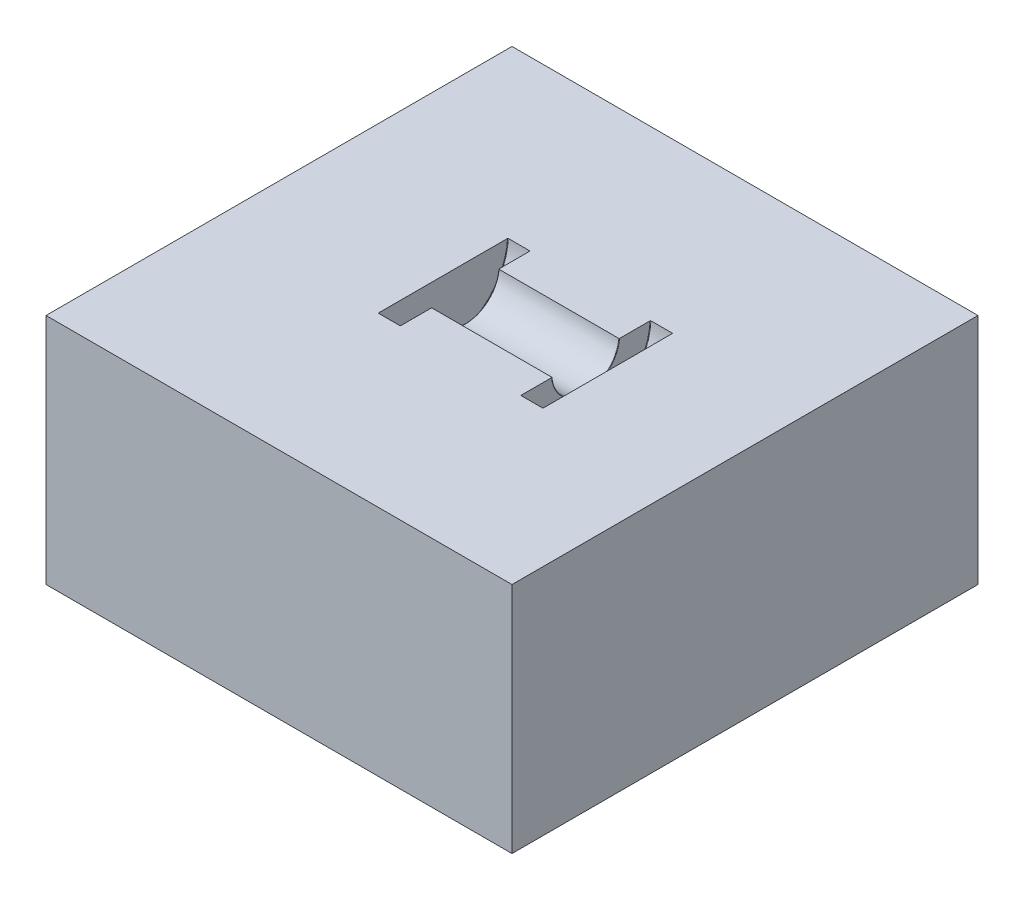
from build123d import *

# Parameters (mm, degrees)
SKETCH1_W           = 300
SKETCH1_H           = 300
BOSS_EXTRUDE1_DEPTH = 150


# Read off the part's stored shape, not the designer's step: Cavity1
with BuildPart() as part:
    # Sketch1 → Boss-Extrude1 (new body)
    with BuildSketch(Plane(origin=(0, 0, 0), x_dir=(1, 0, 0), z_dir=(0, 1, 0))):
        Rectangle(SKETCH1_W, SKETCH1_H)
    extrude(amount=BOSS_EXTRUDE1_DEPTH)

    # Cavity1 outline → Cavity1 (revolve, cut)
    with BuildSketch(Plane(origin=(0, 152.053618149, 0), x_dir=(0, 1, 0), z_dir=(0, 0, -1))):
        with BuildLine():
            Line((41.5, 61.660319704), (2.053618149, 61.660319704))
            Line((2.053618149, 61.660319704), (2.053618149, -44.379680296))
            Line((2.053618149, -44.379680296), (41.5, -44.379680296))
            ThreePointArc((41.5, -44.379680296), (41.712132035, -44.291812331), (41.8, -44.079680296))
            Line((41.8, -44.079680296), (41.8, -30.439680296))
            ThreePointArc((41.8, -30.439680296), (41.712132034, -30.227548262), (41.5, -30.139680296))
            Line((41.5, -30.139680296), (22, -30.139680296))
            ThreePointArc((22, -30.139680296), (21.787867965, -30.051812331), (21.7, -29.839680296))
            Line((21.7, -29.839680296), (21.7, 47.120319704))
            ThreePointArc((21.7, 47.120319704), (21.787867966, 47.332451738), (22, 47.420319704))
            Line((22, 47.420319704), (41.5, 47.420319704))
            ThreePointArc((41.5, 47.420319704), (41.712132035, 47.508187669), (41.8, 47.720319704))
            Line((41.8, 47.720319704), (41.8, 61.360319704))
            ThreePointArc((41.8, 61.360319704), (41.712132034, 61.572451738), (41.5, 61.660319704))
        make_face()
    revolve(axis=Axis((0, 152.053618149, 0), (1, 0, 0)), mode=Mode.SUBTRACT)


solid = part.part
